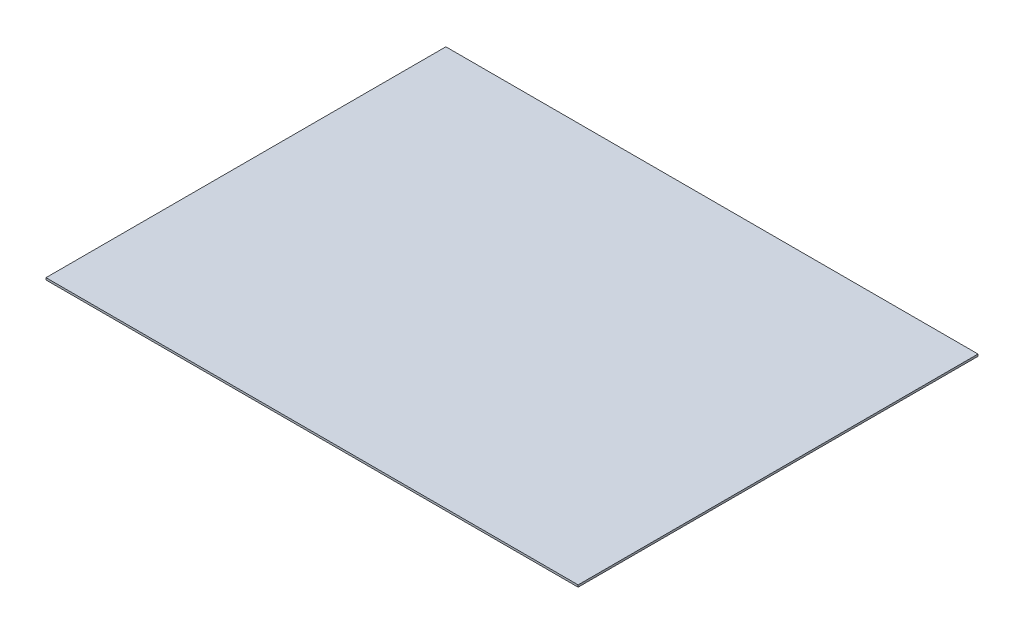
from build123d import *

# Parameters (mm, degrees)
SKETCH3_W           = 2615
SKETCH3_H           = 1965
BOSS_EXTRUDE1_DEPTH = 10


with BuildPart() as part:
    # Sketch3 → Boss-Extrude1 (new body)
    with BuildSketch(Plane(origin=(0, 0, 0), x_dir=(1, 0, 0), z_dir=(0, 1, 0))):
        with Locations((1307.5, 982.5)):
            Rectangle(SKETCH3_W, SKETCH3_H)
    extrude(amount=BOSS_EXTRUDE1_DEPTH)


solid = part.part
